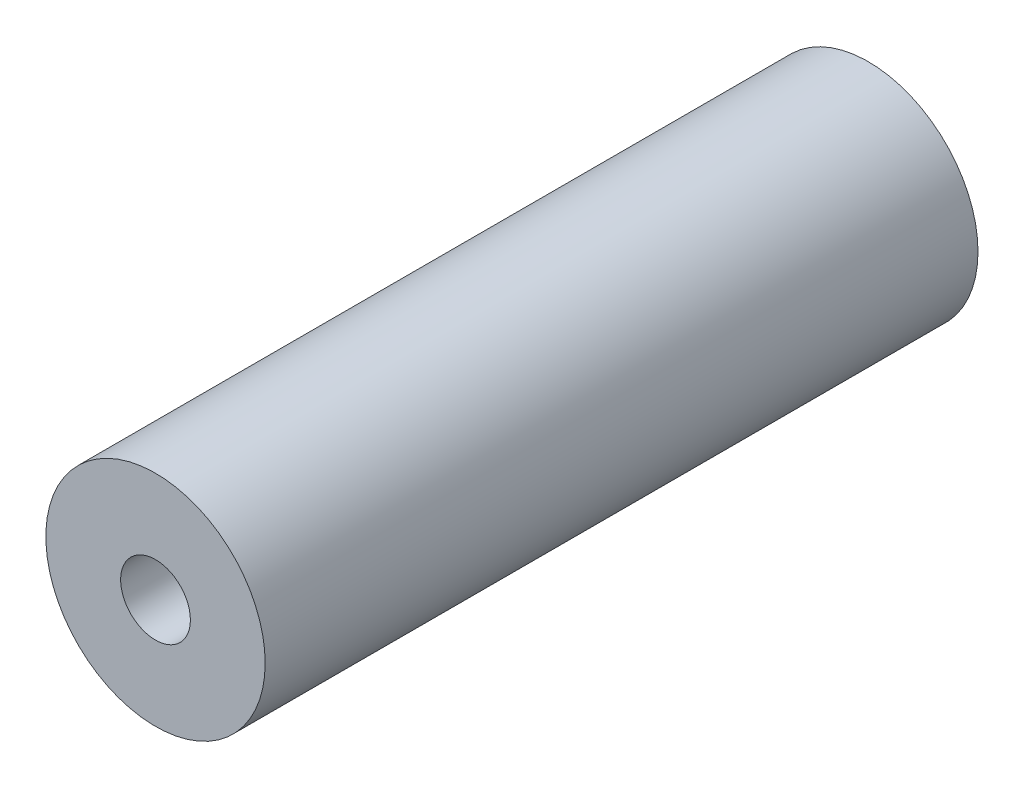
from build123d import *

# Parameters (mm, degrees)
SKETCH1_R                            = 6.35
BOSS_EXTRUDE1_DEPTH                  = 20.6375
F_10_32_TAPPED_HOLE1_D               = 4.0386
F_10_32_TAPPED_HOLE1_DEPTH           = 12.02944
F_10_32_TAPPED_HOLE1_TIP             = 1.213317848
F_10_32_TAPPED_HOLE1_ON_FACE_2_D     = 4.0386
F_10_32_TAPPED_HOLE1_ON_FACE_2_DEPTH = 12.02944
F_10_32_TAPPED_HOLE1_ON_FACE_2_TIP   = 1.213317848


with BuildPart() as part:
    # Sketch1 → Boss-Extrude1 (new, symmetric)
    with BuildSketch(Plane.XY):
        Circle(SKETCH1_R)
    extrude(amount=BOSS_EXTRUDE1_DEPTH, both=True)

    # #10-32 Tapped Hole1
    with Locations(Plane.XY.offset(20.6375)):
        with Locations((0, 0)):
            Hole(F_10_32_TAPPED_HOLE1_D / 2, depth=F_10_32_TAPPED_HOLE1_DEPTH)
            with Locations((0, 0, -(F_10_32_TAPPED_HOLE1_DEPTH + F_10_32_TAPPED_HOLE1_TIP / 2))):  # 118° drill point
                Cone(0, F_10_32_TAPPED_HOLE1_D / 2, F_10_32_TAPPED_HOLE1_TIP, mode=Mode.SUBTRACT)

    # #10-32 Tapped Hole1 on face 2
    with Locations(Plane(origin=(0, 0, -20.6375), x_dir=(-1, 0, 0), z_dir=(0, 0, -1))):
        with Locations((0, 0)):
            Hole(F_10_32_TAPPED_HOLE1_ON_FACE_2_D / 2, depth=F_10_32_TAPPED_HOLE1_ON_FACE_2_DEPTH)
            with Locations((0, 0, -(F_10_32_TAPPED_HOLE1_ON_FACE_2_DEPTH + F_10_32_TAPPED_HOLE1_ON_FACE_2_TIP / 2))):  # 118° drill point
                Cone(0, F_10_32_TAPPED_HOLE1_ON_FACE_2_D / 2, F_10_32_TAPPED_HOLE1_ON_FACE_2_TIP, mode=Mode.SUBTRACT)


solid = part.part
